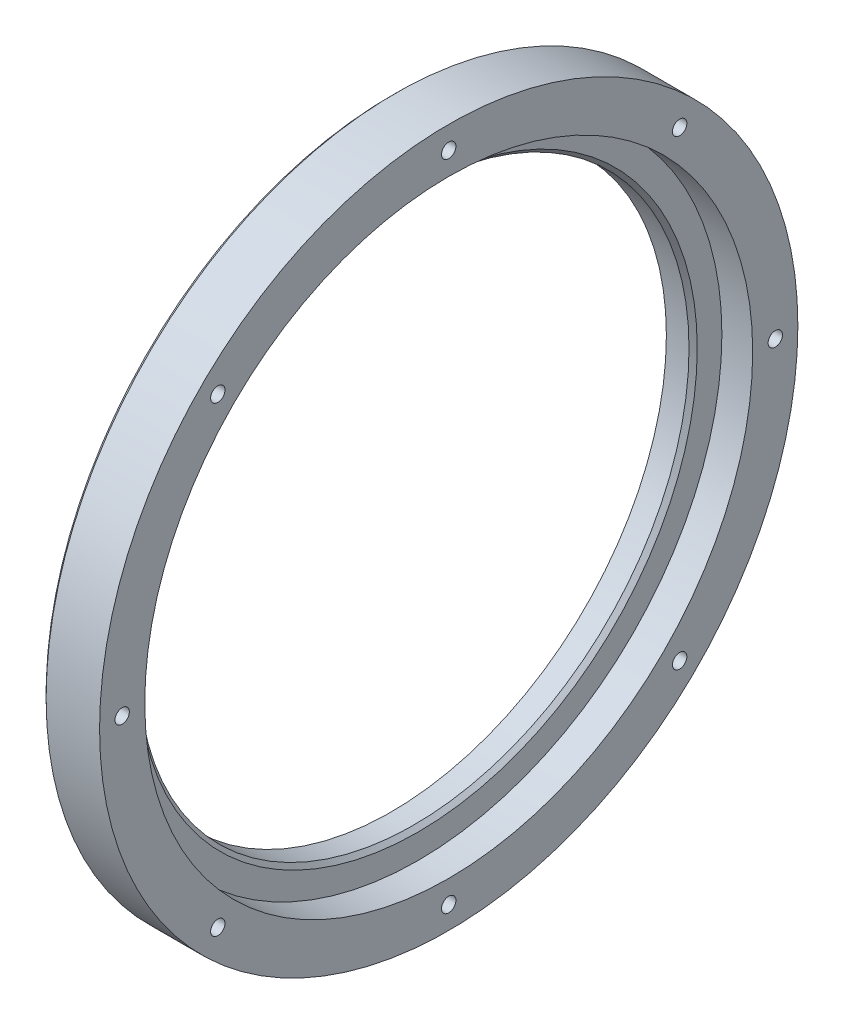
from build123d import *

# Parameters (mm, degrees)
SZKIC2_R                   = 1.75
WYTNIJ_WYCI_GNI_CIE1_DEPTH = 122.733164786
SZKIC4_R                   = 3
WYTNIJ_WYCI_GNI_CIE2_DEPTH = 4
SFAZOWANIE1_SIZE           = 1


with BuildPart() as part:
    # Szkic1 → Obrót1 (revolve)
    with BuildSketch(Plane.XY):
        Polygon((-272.858046523, 75.009269975), (-280.358046523, 75.009269975), (-280.358046523, 68.009269975), (-286.871214876, 68.009269975), (-286.871214876, 85.009269975), (-285.871214876, 86.009269975), (-272.858046523, 86.009269975), align=None)
    revolve(axis=Axis((-268.908046523, 1.009269975, 0), (-1, 0, 0)))

    # Szkic2 → Wytnij-wyciągnięcie1 (cut, through all)
    with BuildSketch(Plane.ZY.offset(286.871214876)):
        with Locations((79.5, 1.009269975)):
            Circle(SZKIC2_R)
        with Locations((56.214989104, -55.20571913)):
            Circle(SZKIC2_R)
        with Locations((0, -78.490730025)):
            Circle(SZKIC2_R)
        with Locations((-56.214989104, -55.20571913)):
            Circle(SZKIC2_R)
        with Locations((-79.5, 1.009269975)):
            Circle(SZKIC2_R)
        with Locations((-56.214989104, 57.224259079)):
            Circle(SZKIC2_R)
        with Locations((0, 80.509269975)):
            Circle(SZKIC2_R)
        with Locations((56.214989104, 57.224259079)):
            Circle(SZKIC2_R)
    extrude(amount=-WYTNIJ_WYCI_GNI_CIE1_DEPTH, mode=Mode.SUBTRACT)

    # Szkic4 → Wytnij-wyciągnięcie2 (cut)
    with BuildSketch(Plane.ZY.offset(286.871214876)):
        with Locations((79.5, 1.009269975)):
            Circle(SZKIC4_R)
        with Locations((56.214989104, -55.20571913)):
            Circle(SZKIC4_R)
        with Locations((0, -78.490730025)):
            Circle(SZKIC4_R)
        with Locations((-56.214989104, -55.20571913)):
            Circle(SZKIC4_R)
        with Locations((-79.5, 1.009269975)):
            Circle(SZKIC4_R)
        with Locations((-56.214989104, 57.224259079)):
            Circle(SZKIC4_R)
        with Locations((0, 80.509269975)):
            Circle(SZKIC4_R)
        with Locations((56.214989104, 57.224259079)):
            Circle(SZKIC4_R)
    extrude(amount=-WYTNIJ_WYCI_GNI_CIE2_DEPTH, mode=Mode.SUBTRACT)

    # Sfazowanie1
    sfazowanie1_edges = [part.edges().sort_by_distance(p)[0] for p in [
        (-280.358046523, -65.990730025, 0),
    ]]
    chamfer(sfazowanie1_edges, length=SFAZOWANIE1_SIZE)


solid = part.part
